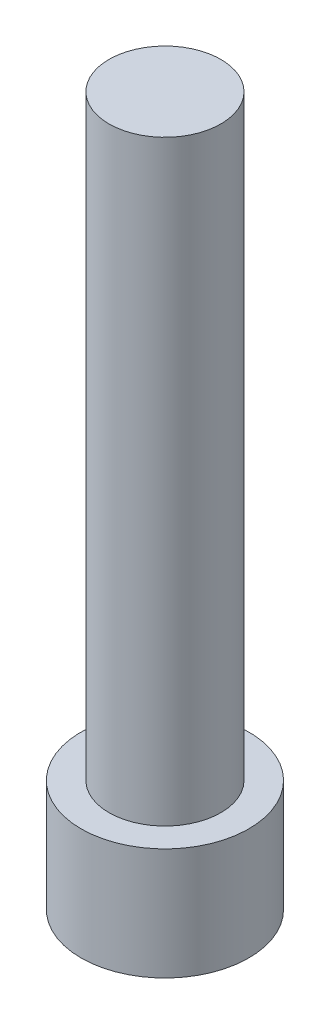
from build123d import *

# Parameters (mm, degrees)
SKETCH_1_R          = 2.25
EXTRUDE_1_DEPTH     = 3
SKETCH_2_R          = 1.5
EXTRUDE_2_DEPTH     = 16
CUT_EXTRUDE_1_DEPTH = 1.5


with BuildPart() as part:
    # 草图1 → 凸台-拉伸1 (new body)
    with BuildSketch(Plane(origin=(0, 0, 0), x_dir=(1, 0, 0), z_dir=(0, 1, 0))):
        Circle(SKETCH_1_R)
    extrude(amount=EXTRUDE_1_DEPTH)

    # 草图2 → 凸台-拉伸2 (add)
    with BuildSketch(Plane(origin=(0, 3, 0), x_dir=(1, 0, 0), z_dir=(0, 1, 0))):
        Circle(SKETCH_2_R)
    extrude(amount=EXTRUDE_2_DEPTH)

    # 草图3 → 切除-拉伸1 (cut)
    with BuildSketch(Plane.XZ):
        Polygon((1.091681609, -0.944226984), (1.36356536, 0.473310514), (0.271883751, 1.417537498), (-1.091681609, 0.944226984), (-1.36356536, -0.473310514), (-0.271883751, -1.417537498), align=None)
    extrude(amount=-CUT_EXTRUDE_1_DEPTH, mode=Mode.SUBTRACT)


solid = part.part
